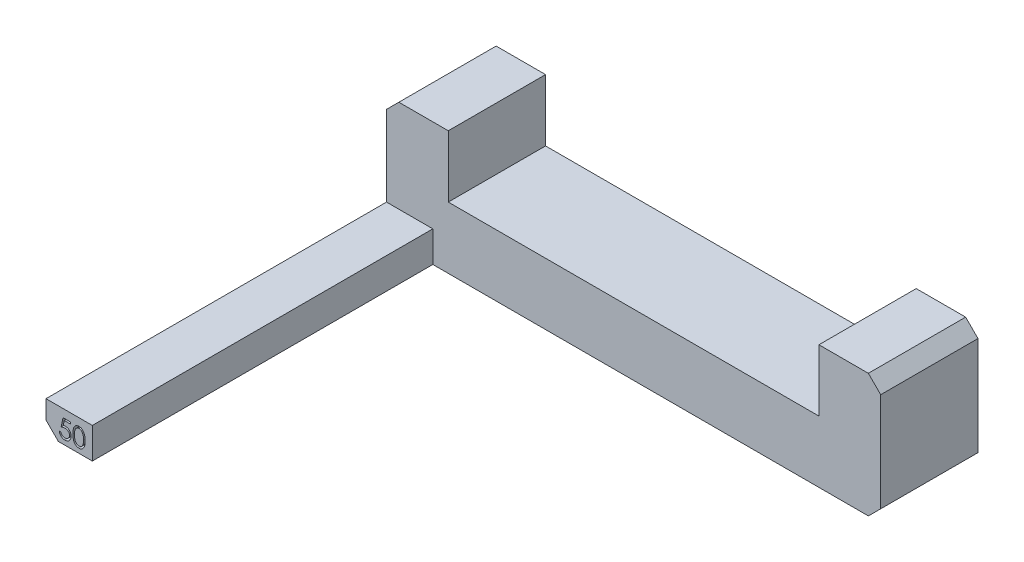
from build123d import *

# Parameters (mm, degrees)
BOSS_EXTRUDE1_DEPTH = 20
SKETCH2_W           = 9.525
SKETCH2_H           = 6.35
BOSS_EXTRUDE2_DEPTH = 70
CUT_EXTRUDE1_DEPTH  = 2
CHAMFER1_SIZE       = 2.54


with BuildPart() as part:
    # Sketch1 → Boss-Extrude1 (new body)
    with BuildSketch(Plane.XY):
        Polygon((-101.6, 0), (0, 0), (0, 25.4), (-12.7, 25.4), (-12.7, 12.7), (-88.9, 12.7), (-88.9, 25.4), (-101.6, 25.4), align=None)
    extrude(amount=BOSS_EXTRUDE1_DEPTH)

    # Sketch2 → Boss-Extrude2 (add)
    with BuildSketch(Plane.XY.offset(20)):
        with Locations((-96.8375, 3.175)):
            Rectangle(SKETCH2_W, SKETCH2_H)
    extrude(amount=BOSS_EXTRUDE2_DEPTH)

    # Sketch3 → Cut-Extrude1 (cut)
    # profile 1 of 2: a face of its own
    with BuildSketch(Plane.XY.offset(90)):
        with BuildLine():
            Line((-96.590555556, 4.720166667), (-96.590555556, 4.340252137))
            Line((-96.590555556, 4.340252137), (-97.850506477, 4.340252137))
            Line((-97.850506477, 4.340252137), (-98.050110009, 3.365979133))
            add(Edge.make_bspline(
                [(-98.050110009, 3.365979133), (-98.010892542, 3.376806171), (-97.934914903, 3.397781844), (-97.82277405, 3.421071284), (-97.716313968, 3.435110546), (-97.647230867, 3.437027516), (-97.613801916, 3.437955128)],
                knots=[0, 0, 0, 0, 1.100273476, 2.13160584, 3.095893838, 4, 4, 4, 4], degree=3))
            add(Edge.make_bspline(
                [(-97.613801916, 3.437955128), (-97.572438292, 3.437059846), (-97.491107071, 3.435299498), (-97.372109186, 3.418395958), (-97.258515207, 3.391789548), (-97.150562699, 3.354620329), (-97.048051949, 3.307090861), (-96.951926113, 3.247718425), (-96.860742322, 3.178362316), (-96.77613641, 3.098622178), (-96.699381517, 3.010863467), (-96.631895845, 2.91650472), (-96.57457377, 2.816462944), (-96.528471971, 2.7097823), (-96.491658551, 2.597642196), (-96.467156023, 2.478862713), (-96.450840006, 2.354563453), (-96.449017147, 2.269574449), (-96.448087607, 2.226235544)],
                knots=[0, 0, 0, 0, 1.052922333, 2.070308379, 3.05430497, 4.020497103, 4.973039431, 5.925935799, 6.892292201, 7.88610001, 8.88166317, 9.857072816, 10.836096531, 11.812156883, 12.81219415, 13.836441305, 14.89672472, 16, 16, 16, 16], degree=3))
            add(Edge.make_bspline(
                [(-96.448087607, 2.226235544), (-96.448791478, 2.196049527), (-96.450189709, 2.136085432), (-96.457300214, 2.047032819), (-96.470990513, 1.959865488), (-96.489371355, 1.874571873), (-96.513228747, 1.791313454), (-96.542109662, 1.70985192), (-96.577453792, 1.630694295), (-96.616221997, 1.553091585), (-96.65987452, 1.478798165), (-96.70832344, 1.409319654), (-96.759510251, 1.34361379), (-96.814587384, 1.282385256), (-96.874066771, 1.226036395), (-96.937228069, 1.174232797), (-97.00356728, 1.126098389), (-97.074110745, 1.083587049), (-97.147286539, 1.044467921), (-97.224151403, 1.01237551), (-97.302955644, 0.983683535), (-97.384833471, 0.960813451), (-97.469599422, 0.942893165), (-97.557393226, 0.930721696), (-97.647754435, 0.921856633), (-97.70900549, 0.921301688), (-97.739945413, 0.921021368)],
                knots=[0, 0, 0, 0, 1.056347294, 2.098418968, 3.122841568, 4.141288669, 5.149314143, 6.15115421, 7.162517403, 8.180376062, 9.185164535, 10.17417709, 11.141909838, 12.097768115, 13.052685741, 14.0056014, 14.954263652, 15.917497458, 16.885230207, 17.854509472, 18.828990115, 19.81800267, 20.826176721, 21.857883937, 22.917946725, 24, 24, 24, 24], degree=3))
            add(Edge.make_bspline(
                [(-97.739945413, 0.921021368), (-97.776853921, 0.921752504), (-97.84946705, 0.92319093), (-97.955851317, 0.938238827), (-98.058207608, 0.959790638), (-98.155711965, 0.992214024), (-98.249238219, 1.032840577), (-98.337527262, 1.084186859), (-98.422835041, 1.142373077), (-98.501693614, 1.211038117), (-98.574883834, 1.286090547), (-98.640401556, 1.367537384), (-98.698751258, 1.454034377), (-98.74899854, 1.54600159), (-98.791858946, 1.643197369), (-98.825529808, 1.745985878), (-98.852706067, 1.853830049), (-98.864203187, 1.928075847), (-98.870042735, 1.965786325)],
                knots=[0, 0, 0, 0, 1.0467383, 2.05933395, 3.04377827, 4.011590433, 4.970194871, 5.932262533, 6.905835911, 7.896367577, 8.894135286, 9.877477877, 10.858688626, 11.851381753, 12.8477658, 13.868841284, 14.917554742, 16, 16, 16, 16], degree=3))
            Line((-98.870042735, 1.965786325), (-98.537617521, 1.965786325))
            add(Edge.make_bspline(
                [(-98.537617521, 1.965786325), (-98.529438131, 1.930462913), (-98.51371689, 1.862569353), (-98.479209139, 1.76718035), (-98.437017754, 1.682175838), (-98.386848152, 1.606431363), (-98.32699937, 1.540381841), (-98.258705724, 1.48152045), (-98.182137717, 1.428418438), (-98.097054883, 1.38415601), (-98.007294374, 1.346406579), (-97.913349076, 1.321269368), (-97.817776976, 1.303594257), (-97.753135701, 1.301824977), (-97.720652878, 1.300935897)],
                knots=[0, 0, 0, 0, 1.136247022, 2.183929868, 3.172523383, 4.106158343, 5.02341133, 5.958108904, 6.928429099, 7.938127109, 8.96079061, 9.975095812, 10.982467395, 12, 12, 12, 12], degree=3))
            add(Edge.make_bspline(
                [(-97.720652878, 1.300935897), (-97.688946858, 1.301804554), (-97.626517444, 1.303514946), (-97.53464206, 1.316679567), (-97.445940101, 1.336954663), (-97.361286815, 1.367296927), (-97.279200853, 1.404174254), (-97.201758612, 1.451497709), (-97.126719734, 1.505959562), (-97.056416626, 1.568355329), (-96.992028209, 1.637114922), (-96.935136314, 1.710645163), (-96.887747414, 1.789085493), (-96.847812149, 1.871077913), (-96.817487408, 1.957521052), (-96.795854036, 2.048009796), (-96.783150798, 2.14276765), (-96.7814033, 2.207399336), (-96.780512821, 2.240333934)],
                knots=[0, 0, 0, 0, 1.027316725, 2.022795036, 3.002884548, 3.971462791, 4.93288096, 5.914575861, 6.907176829, 7.935150275, 8.956128384, 9.956726525, 10.942570165, 11.921478529, 12.907843606, 13.90538589, 14.932640048, 16, 16, 16, 16], degree=3))
            add(Edge.make_bspline(
                [(-96.780512821, 2.240333934), (-96.781209711, 2.270047438), (-96.782573776, 2.328207394), (-96.793718629, 2.413296554), (-96.813104092, 2.493807191), (-96.840011031, 2.570128088), (-96.87417351, 2.642331231), (-96.915920858, 2.710491137), (-96.966036537, 2.773709444), (-97.023283786, 2.832015729), (-97.085998546, 2.885826555), (-97.15525984, 2.931699047), (-97.229618263, 2.970290026), (-97.308177922, 3.003593658), (-97.39280744, 3.02751278), (-97.481830876, 3.045470459), (-97.576209558, 3.055858384), (-97.64073687, 3.057299716), (-97.673905582, 3.058040598)],
                knots=[0, 0, 0, 0, 1.045622112, 2.046656509, 3.013763289, 3.955457236, 4.890082067, 5.820317437, 6.762574623, 7.722996705, 8.69280354, 9.665887285, 10.63943826, 11.638615906, 12.663482002, 13.728887084, 14.832589034, 16, 16, 16, 16], degree=3))
            add(Edge.make_bspline(
                [(-97.673905582, 3.058040598), (-97.702617032, 3.057426139), (-97.761898891, 3.056157437), (-97.852833883, 3.046816062), (-97.948392623, 3.031746142), (-98.048208798, 3.011017363), (-98.152582169, 2.98389114), (-98.261292476, 2.95138496), (-98.374568292, 2.912520845), (-98.450892883, 2.883170919), (-98.490128205, 2.868083333)],
                knots=[0, 0, 0, 0, 0.817624296, 1.688186739, 2.600797293, 3.572016777, 4.590301741, 5.671205678, 6.80286297, 8, 8, 8, 8], degree=3))
            Line((-98.490128205, 2.868083333), (-98.110213675, 4.720166667))
            Line((-98.110213675, 4.720166667), (-96.590555556, 4.720166667))
        make_face()
    # profile 2 of 2: a face of its own
    with BuildSketch(Plane.XY.offset(90)):
        with BuildLine():
            add(Edge.make_bspline(
                [(-96.068173077, 2.866599292), (-96.067825924, 2.925969028), (-96.067151576, 3.041295594), (-96.059649663, 3.209342674), (-96.047187426, 3.366992313), (-96.030108706, 3.514252058), (-96.009325177, 3.651159925), (-95.981580454, 3.777350043), (-95.950028571, 3.89340646), (-95.913460566, 3.999707628), (-95.872198489, 4.097685697), (-95.827288897, 4.189152369), (-95.776949489, 4.273969247), (-95.724057257, 4.353490075), (-95.666471147, 4.426413152), (-95.605829928, 4.493768303), (-95.539766775, 4.553998848), (-95.470527425, 4.608869518), (-95.397485, 4.656970208), (-95.322721512, 4.69933819), (-95.245722358, 4.73553305), (-95.166277314, 4.763992094), (-95.085100441, 4.787498574), (-95.001907962, 4.803573543), (-94.916562518, 4.813687938), (-94.858955916, 4.814654903), (-94.829740752, 4.815145299)],
                knots=[0, 0, 0, 0, 1.646270934, 3.197905019, 4.663502075, 6.030701355, 7.308322542, 8.50163776, 9.611534131, 10.641858119, 11.616356847, 12.558055219, 13.465016945, 14.349605745, 15.204443733, 16.039544428, 16.859896111, 17.680448484, 18.487036065, 19.28249412, 20.06191084, 20.843045899, 21.620316918, 22.403196591, 23.190181807, 24, 24, 24, 24], degree=3))
            add(Edge.make_bspline(
                [(-94.829740752, 4.815145299), (-94.800281537, 4.814629028), (-94.741696428, 4.813602327), (-94.655082031, 4.803734488), (-94.570468617, 4.787360883), (-94.488216921, 4.764161185), (-94.40765131, 4.735379094), (-94.329401945, 4.699303561), (-94.252982784, 4.657310093), (-94.17960823, 4.60796649), (-94.108472762, 4.552951914), (-94.041323667, 4.490761423), (-93.978154835, 4.42202297), (-93.91817347, 4.347471998), (-93.863081296, 4.265678616), (-93.810616081, 4.178065433), (-93.763655676, 4.083100268), (-93.718428145, 3.982367606), (-93.679389417, 3.873080234), (-93.644182641, 3.755854196), (-93.615735732, 3.629304848), (-93.592040419, 3.494096155), (-93.573683738, 3.349731569), (-93.560314191, 3.196520551), (-93.553251843, 3.034362305), (-93.551921834, 2.923493581), (-93.551239316, 2.866599292)],
                knots=[0, 0, 0, 0, 0.810914788, 1.612654377, 2.396697861, 3.181598691, 3.963628158, 4.749916497, 5.551656086, 6.361998678, 7.18212741, 8.025565596, 8.878627764, 9.750805457, 10.657531673, 11.591944965, 12.560506719, 13.57287815, 14.630710178, 15.753379473, 16.941251878, 18.199788006, 19.531962791, 20.947069417, 22.433333509, 24, 24, 24, 24], degree=3))
            add(Edge.make_bspline(
                [(-93.551239316, 2.866599292), (-93.55192891, 2.809953156), (-93.553272555, 2.699580471), (-93.56023502, 2.538151855), (-93.573949571, 2.385753926), (-93.591105142, 2.242021186), (-93.614865744, 2.107551873), (-93.644081212, 1.981880665), (-93.67651947, 1.864464856), (-93.716561294, 1.756266347), (-93.760387629, 1.655775774), (-93.808071045, 1.561936375), (-93.859156611, 1.473918715), (-93.914813033, 1.392427316), (-93.974136229, 1.316884904), (-94.038395888, 1.24862492), (-94.105780591, 1.186002626), (-94.177125398, 1.130279654), (-94.251644289, 1.081506569), (-94.327800979, 1.037888577), (-94.406946727, 1.002717308), (-94.487287935, 0.972517723), (-94.569973789, 0.949445578), (-94.654901219, 0.933492414), (-94.741638235, 0.922303875), (-94.800271559, 0.92145035), (-94.829740752, 0.921021368)],
                knots=[0, 0, 0, 0, 1.561518951, 3.042555995, 4.452378317, 5.7783523, 7.031515105, 8.214008947, 9.334062868, 10.386615937, 11.391082383, 12.354592575, 13.286541444, 14.194233754, 15.072674879, 15.931287219, 16.775624067, 17.606195743, 18.42308326, 19.229000347, 20.022332153, 20.807536673, 21.593273796, 22.3848459, 23.188221202, 24, 24, 24, 24], degree=3))
            add(Edge.make_bspline(
                [(-94.829740752, 0.921021368), (-94.858955106, 0.921514927), (-94.91656011, 0.92248813), (-95.00191726, 0.932556829), (-95.084766179, 0.94874457), (-95.165515694, 0.971410476), (-95.244580089, 0.999154511), (-95.320881992, 1.035300493), (-95.395269791, 1.076929049), (-95.467545021, 1.124337537), (-95.536349558, 1.178652985), (-95.602070582, 1.238728524), (-95.663057061, 1.306063301), (-95.719819812, 1.379594103), (-95.773767388, 1.458644451), (-95.823391975, 1.544293646), (-95.869292796, 1.636202075), (-95.911248823, 1.734963531), (-95.948447826, 1.842019163), (-95.98130665, 1.95859371), (-96.0072508, 2.085716091), (-96.029457761, 2.222365305), (-96.0473694, 2.369128548), (-96.059597727, 2.526085497), (-96.067155619, 2.693138343), (-96.067827735, 2.807723854), (-96.068173077, 2.866599292)],
                knots=[0, 0, 0, 0, 0.810891512, 1.598919785, 2.382837074, 3.152667961, 3.926044502, 4.706494248, 5.493654104, 6.291793342, 7.103789334, 7.925228297, 8.761435821, 9.622817696, 10.50288917, 11.416980706, 12.369136599, 13.353924996, 14.394355917, 15.514179734, 16.714354668, 17.994756427, 19.357759367, 20.818452758, 22.365282078, 24, 24, 24, 24], degree=3))
        make_face()
        with BuildLine():
            add(Edge.make_bspline(
                [(-95.735747863, 2.868083333), (-95.735621448, 2.818607627), (-95.735376102, 2.722584996), (-95.728966623, 2.583050878), (-95.720235128, 2.45290728), (-95.708973088, 2.331988954), (-95.692248301, 2.220705191), (-95.673508617, 2.11829061), (-95.650703556, 2.025287201), (-95.623721328, 1.941056768), (-95.592988284, 1.864169837), (-95.559432912, 1.792625217), (-95.523385313, 1.725577751), (-95.483042546, 1.663629683), (-95.43910577, 1.606578992), (-95.392567405, 1.553415911), (-95.341690586, 1.506005773), (-95.271307459, 1.449144851), (-95.178389523, 1.390387101), (-95.061316208, 1.339220823), (-94.941017098, 1.307066057), (-94.859365358, 1.302976915), (-94.818610443, 1.300935897)],
                knots=[0, 0, 0, 0, 1.459021318, 2.831673884, 4.118529203, 5.306027144, 6.411944654, 7.436330062, 8.375795394, 9.233974572, 10.042671642, 10.816086306, 11.563610507, 12.285937304, 12.993564865, 13.685989202, 14.367179055, 15.041617293, 16.353048772, 17.594441528, 18.799311195, 20, 20, 20, 20], degree=3))
            add(Edge.make_bspline(
                [(-94.818610443, 1.300935897), (-94.777591908, 1.302626882), (-94.695639524, 1.30600536), (-94.575906257, 1.338600691), (-94.459669221, 1.387780953), (-94.368576418, 1.44593373), (-94.299274059, 1.501314545), (-94.249620245, 1.548531715), (-94.204046244, 1.601401674), (-94.160821714, 1.658445096), (-94.121177526, 1.720751808), (-94.085127372, 1.7880222), (-94.052230829, 1.86044308), (-94.033488756, 1.910999387), (-94.023906417, 1.936847523)],
                knots=[0, 0, 0, 0, 1.353760809, 2.704726607, 4.075137775, 5.516104923, 6.260822281, 7.007110065, 7.778089737, 8.566572457, 9.372053459, 10.217411131, 11.088608312, 12, 12, 12, 12], degree=3))
            add(Edge.make_bspline(
                [(-94.023906417, 1.936847523), (-94.012739129, 1.969898997), (-93.990064746, 2.037007664), (-93.960842285, 2.141109196), (-93.937828404, 2.250332121), (-93.917123842, 2.364023703), (-93.902991858, 2.483022387), (-93.891617089, 2.606959976), (-93.884917112, 2.735929918), (-93.884086584, 2.823554617), (-93.88366453, 2.868083333)],
                knots=[0, 0, 0, 0, 0.884706709, 1.796334032, 2.740027952, 3.714592787, 4.726048262, 5.777819803, 6.87074269, 8, 8, 8, 8], degree=3))
            add(Edge.make_bspline(
                [(-93.88366453, 2.868083333), (-93.884246814, 2.912604848), (-93.885385885, 2.999698447), (-93.889739855, 3.127246855), (-93.900983138, 3.248391902), (-93.913470539, 3.363655485), (-93.931882598, 3.472399556), (-93.95173461, 3.575534462), (-93.978405893, 3.671782497), (-94.006895988, 3.762650554), (-94.039503657, 3.847106247), (-94.075397809, 3.925543337), (-94.113732504, 3.998340504), (-94.155369708, 4.065298017), (-94.199815139, 4.126715792), (-94.248241879, 4.181362405), (-94.298729007, 4.230931529), (-94.369443862, 4.287512748), (-94.462020819, 4.345204293), (-94.577215795, 4.398296388), (-94.697093894, 4.428785165), (-94.778134133, 4.433083784), (-94.818610443, 4.435230769)],
                knots=[0, 0, 0, 0, 1.31362396, 2.569729283, 3.763502607, 4.902122613, 5.988968491, 7.01645872, 7.998833611, 8.933434873, 9.825090667, 10.667526885, 11.477055099, 12.250526234, 12.991942729, 13.710640831, 14.402115721, 15.076753259, 16.378508321, 17.609869233, 18.806226677, 20, 20, 20, 20], degree=3))
            add(Edge.make_bspline(
                [(-94.818610443, 4.435230769), (-94.859579153, 4.433080822), (-94.941591208, 4.428777009), (-95.062715294, 4.398409983), (-95.178819066, 4.345479594), (-95.271151214, 4.287321666), (-95.341915388, 4.231930287), (-95.391744572, 4.183896289), (-95.438465938, 4.131354004), (-95.48150592, 4.073778644), (-95.521817078, 4.011902797), (-95.55883865, 3.945239687), (-95.592194491, 3.873451493), (-95.622975625, 3.796599099), (-95.650040159, 3.712375933), (-95.672364603, 3.619487082), (-95.692988401, 3.517398246), (-95.707588394, 3.405511767), (-95.720567535, 3.284563155), (-95.728908629, 3.154094659), (-95.735397543, 3.014326523), (-95.735628751, 2.917807414), (-95.735747863, 2.868083333)],
                knots=[0, 0, 0, 0, 1.207732386, 2.417664972, 3.655092373, 4.956220595, 5.625982001, 6.301752483, 6.994047911, 7.697131622, 8.419323945, 9.170223765, 9.943494443, 10.752040957, 11.610060368, 12.549350801, 13.567764191, 14.679664412, 15.874934091, 17.154273443, 18.533957287, 20, 20, 20, 20], degree=3))
        make_face(mode=Mode.SUBTRACT)
    extrude(amount=-CUT_EXTRUDE1_DEPTH, mode=Mode.SUBTRACT)

    # Chamfer1
    chamfer1_edges = [part.edges().sort_by_distance(p)[0] for p in [
        (0, 0, 10),
        (-101.6, 0, 45),
        (0, 25.4, 10),
        (-101.6, 25.4, 10),
    ]]
    chamfer(chamfer1_edges, length=CHAMFER1_SIZE)


solid = part.part
